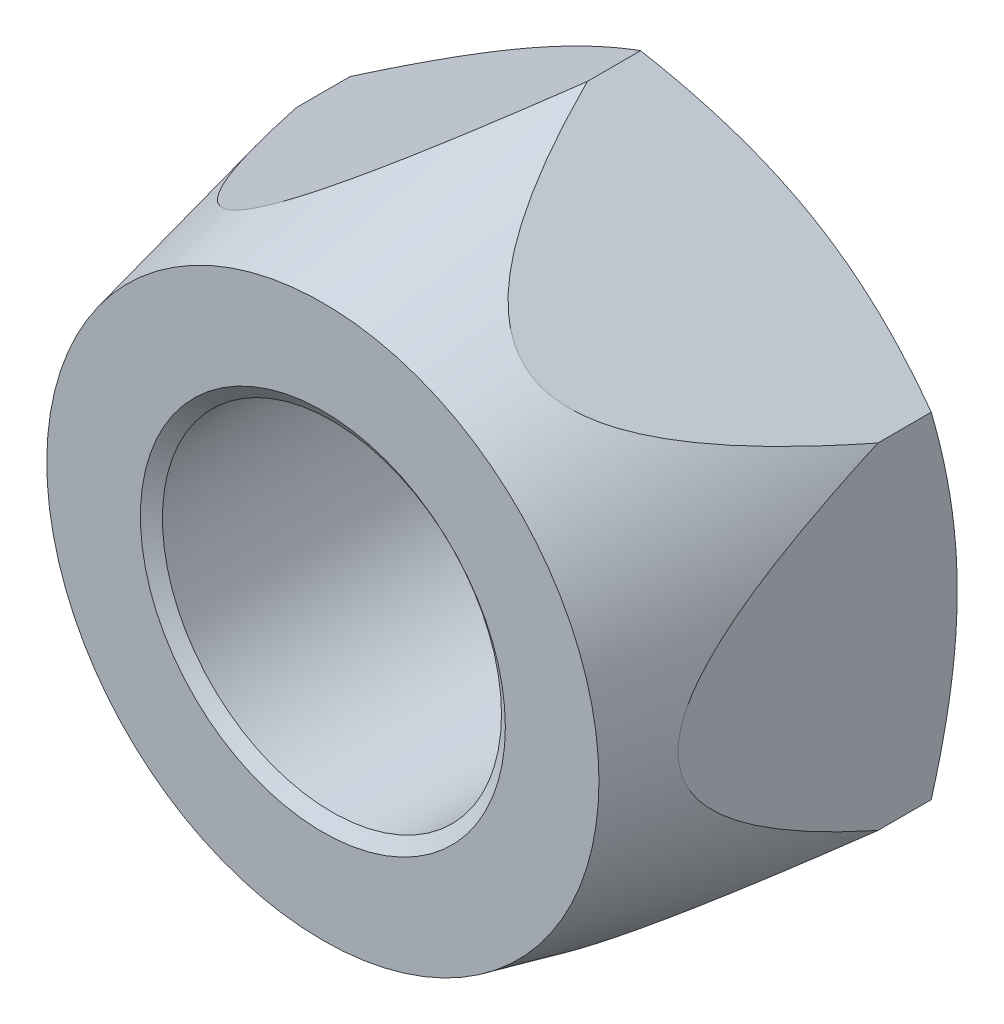
from build123d import *

# Parameters (mm, degrees)
BASENUT_START = -22.5298
BASENUTSKE_R  = 11.1125
BASENUT_DEPTH = 22.5298


# Read off the part's stored shape, not the designer's step: ThreadSchematic
with BuildPart() as part:
    # BaseNutSke → BaseNut (new body)
    with BuildSketch(Plane.XY.offset(BASENUT_START)):
        Polygon((19.05, 10.998522628), (19.05, -10.998522628), (0, -21.997045256), (-19.05, -10.998522628), (-19.05, 10.998522628), (0, 21.997045256), align=None)
        Circle(BASENUTSKE_R, mode=Mode.SUBTRACT)
    extrude(amount=BASENUT_DEPTH)

    # Sketch5 (on Top Plane) → EndChamfer (revolve, cut)
    with BuildSketch(Plane(origin=(0, 0, 0), x_dir=(1, 0, 0), z_dir=(0, 1, 0))):
        Polygon((22.5044, 11.9625), (21.849705952, 11.0275), (22.5552, 11.0275), (22.5552, 11.9625), align=None)
        Polygon((-0.0508, 11.9625), (0, 11.9625), (0.654694048, 11.0275), (-0.0508, 11.0275), align=None)
    revolve(axis=Axis((0, 0, -11.9625), (0.5735764363510524, 0, 0.8191520442889872)), mode=Mode.SUBTRACT)

    # Sketch3 → Double-Chamfer (revolve, cut)
    with BuildSketch(Plane(origin=(0, 0, 0), x_dir=(0, 0, -1), z_dir=(1, 0, 0)), mode=Mode.PRIVATE) as double_chamfer_sk:
        Polygon((22.5298, 19.05), (20.828322628, 21.997045256), (20.828322628, 31.997045256), (32.5298, 31.997045256), (32.5298, 19.05), align=None)
        Polygon((17.330027328, 31.997045256), (-10, 31.997045256), (-10, 18.0975), (0, 18.0975), (17.330027328, 21.997045256), align=None)
    revolve(double_chamfer_sk.sketch.rotate(Axis((0, 0, 0), (0, 0, -1)), 240.000000311), axis=Axis((0, 0, 0), (0, 0, -1)), mode=Mode.SUBTRACT)

    # ThreadSchematic outline → ThreadSchematic (revolve, cut)
    with BuildSketch(Plane.XZ):
        Polygon((11.1125, 0), (11.1125, -0.595176407), (11.9625, 0), align=None)
        Polygon((11.9625, -22.5044), (11.1125, -21.909223593), (11.1125, -22.5298), (11.9625, -22.5298), align=None)
    revolve(axis=Axis((0, 0, 0), (0, 0, 1)), mode=Mode.SUBTRACT)


solid = part.part
